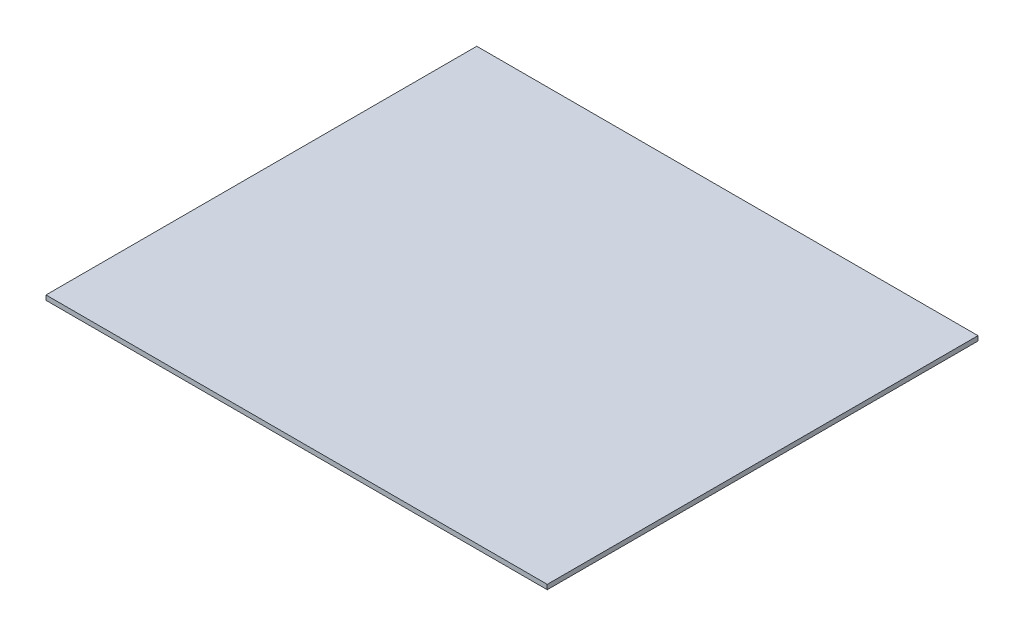
from build123d import *

# Parameters (mm, degrees)
SKETCH1_W           = 320
SKETCH1_H           = 275
BOSS_EXTRUDE1_DEPTH = 3


with BuildPart() as part:
    # Sketch1 → Boss-Extrude1 (new body)
    with BuildSketch(Plane(origin=(0, 0, 0), x_dir=(1, 0, 0), z_dir=(0, 1, 0))):
        Rectangle(SKETCH1_W, SKETCH1_H)
    extrude(amount=BOSS_EXTRUDE1_DEPTH)


solid = part.part
